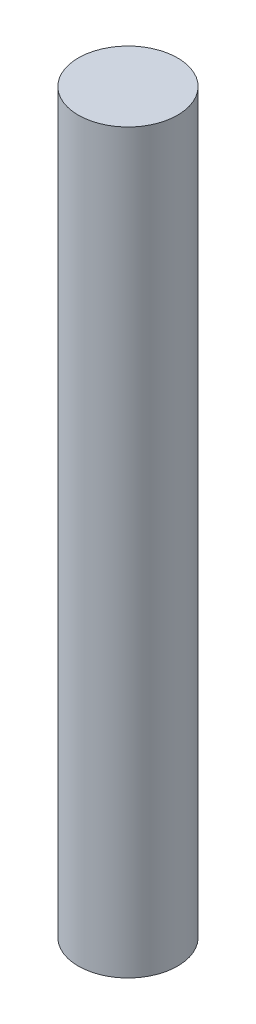
from build123d import *

# Parameters (mm, degrees)
SKETCH1_R           = 26.999999975
BOSS_EXTRUDE1_DEPTH = 400.999999878


with BuildPart() as part:
    # Sketch1 → Boss-Extrude1 (new body)
    with BuildSketch(Plane(origin=(0, 0, 0), x_dir=(1, 0, 0), z_dir=(0, 1, 0))):
        Circle(SKETCH1_R)
    extrude(amount=BOSS_EXTRUDE1_DEPTH)


solid = part.part
